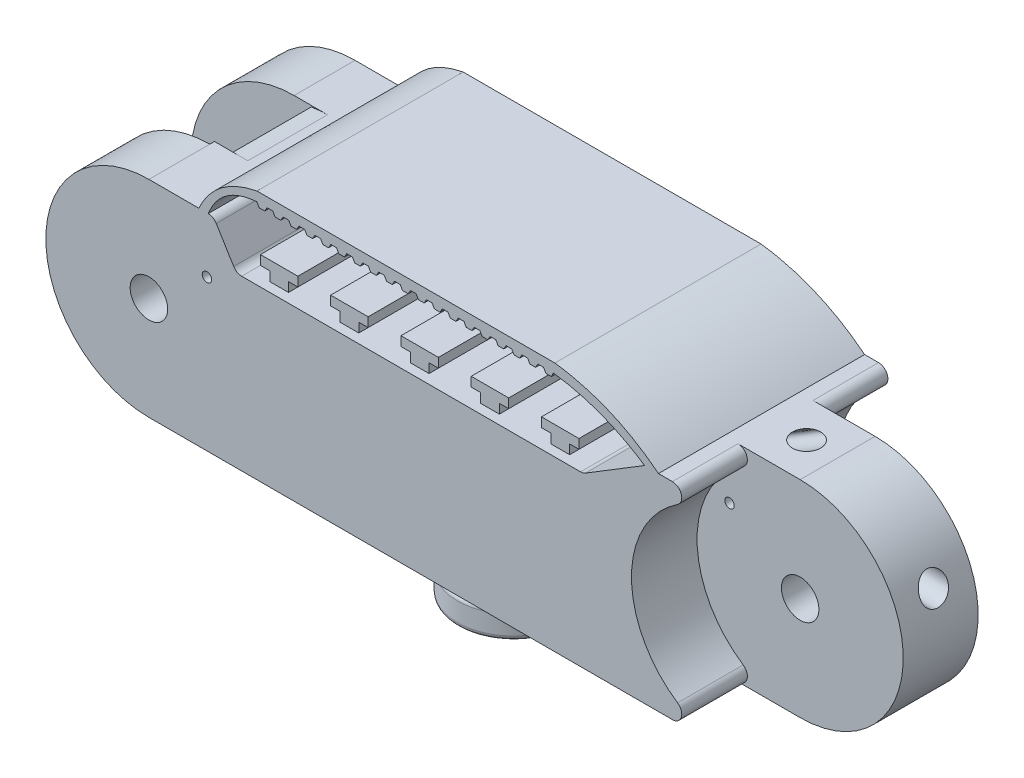
from build123d import *

# Parameters (mm, degrees)
GRIPPER_BODY_DEPTH                 = 11
SKETCH3_R                          = 11
CONNECTION_TO_GRIPPER_1_DEPTH      = 4.5
SKETCH6_R                          = 11
CUT_EXTRUDE8_DEPTH                 = 7
CUT_EXTRUDE9_START                 = -7
SKETCH7_R                          = 11
CUT_EXTRUDE9_DEPTH                 = 7
FILLET4_R                          = 1
FILLET5_R                          = 1
SKETCH9_R                          = 2
JOINT_HOLE_1_DEPTH                 = 8
JOINT_HOLES_2_DEPTH                = 55.847818861
JOINT_HOLES_2_DEPTH_BACK           = 55.847818861
SKETCH10_R                         = 2
SILICON_DEPRESSION_DEPTH           = 22
SKETCH12_W                         = 2
SKETCH12_H                         = 20
SILICON_HOLDER_BOTTOM_HALF_DEPTH   = 1
SKETCH13_W                         = 4
SKETCH13_H                         = 20
SILICON_HOLDER_TOP_HALF_DEPTH      = 1
SILICON_HOLDERS_COUNT              = 5
SILICON_HOLDERS_PITCH              = 7.5
SKETCH16_R                         = 0.5
TENDON_ROUTING_PINS_DEPTH          = 55.847818861
TENDON_HOLE_DEPTH                  = 52.432317017
TENDON_HOLE_DEPTH_BACK             = 52.432317017
SKETCH20_R                         = 1.5
SKETCH21_R                         = 4
ELASTIC_BAND_HOLDER_1ST_HALF_DEPTH = 5
SKETCH22_R                         = 6
ELASTIC_BAND_HOLDER_2ND_HALF_DEPTH = 3
FILLET9_R                          = 0.5
SKETCH26_W                         = 1.823369682
SKETCH26_H                         = 8.500690653
CUT_EXTRUDE12_DEPTH                = 10
FILLET10_R                         = 10
FILLET15_R                         = 1
BOSS_EXTRUDE1_DEPTH                = 22
SKETCH29_R                         = 1.5
CUT_EXTRUDE13_DEPTH                = 14


# Some blends are built 0.0001 mm under size
with BuildPart() as part:
    # Sketch1 → Gripper Body (new, symmetric)
    with BuildSketch(Plane.XY):
        with BuildLine():
            Line((-32.584884937, 24.992819745), (29.915115063, 24.992819745))
            ThreePointArc((29.915115063, 24.992819745), (40.915115063, 13.992819745), (29.915115063, 2.992819745))
            Line((29.915115063, 2.992819745), (18.774000035, 2.992819745))
            Line((18.774000035, 2.992819745), (-23.093344634, 2.992819745))
            Line((-23.093344634, 2.992819745), (-32.584884937, 2.992819745))
            ThreePointArc((-32.584884937, 2.992819745), (-43.584884937, 13.992819745), (-32.584884937, 24.992819745))
        make_face()
    extrude(amount=GRIPPER_BODY_DEPTH, both=True)

    # Sketch3 → Connection to Gripper 1 (cut, symmetric)
    with BuildSketch(Plane.XY):
        with Locations((-32.584884937, 13.992819745)):
            Circle(SKETCH3_R)
    extrude(amount=CONNECTION_TO_GRIPPER_1_DEPTH, both=True, mode=Mode.SUBTRACT)

    # Sketch6 → Cut-Extrude8 (cut)
    with BuildSketch(Plane.XY.offset(11)):
        with Locations((29.915115063, 13.992819745)):
            Circle(SKETCH6_R)
    extrude(amount=-CUT_EXTRUDE8_DEPTH, mode=Mode.SUBTRACT)

    # Sketch7 → Cut-Extrude9 (cut)
    with BuildSketch(Plane(origin=(0, 0, -11), x_dir=(-1, 0, 0), z_dir=(0, 0, -1)).offset(CUT_EXTRUDE9_START)):
        with Locations((-29.915115063, 13.992819745)):
            Circle(SKETCH7_R)
    extrude(amount=CUT_EXTRUDE9_DEPTH, mode=Mode.SUBTRACT)

    # Fillet4
    fillet4_edges = [part.edges().sort_by_distance(p)[0] for p in [
        (29.915115063, 24.992819745, 7.5),
        (29.915115063, 24.992819745, -7.5),
    ]]
    fillet(fillet4_edges, radius=FILLET4_R - 0.0001)  # a hair under: the kernel refuses the full size

    # Fillet5
    fillet5_edges = [part.edges().sort_by_distance(p)[0] for p in [
        (29.915115063, 2.992819745, 7.5),
        (29.915115063, 2.992819745, -7.5),
    ]]
    fillet(fillet5_edges, radius=FILLET5_R)

    # Sketch9 → Joint Hole 1 (cut)
    with BuildSketch(Plane(origin=(0, 0, -4), x_dir=(-1, 0, 0), z_dir=(0, 0, -1))):
        with Locations((-29.915115063, 13.992819745)):
            Circle(SKETCH9_R)
    extrude(amount=-JOINT_HOLE_1_DEPTH, mode=Mode.SUBTRACT)

    # Sketch10 → Joint Holes 2 (cut, two sides: drawn at the far end of the back side and taken through both)
    with BuildSketch(Plane(origin=(0, 0, -11), x_dir=(-1, 0, 0), z_dir=(0, 0, -1)).offset(-JOINT_HOLES_2_DEPTH_BACK)):
        with Locations((32.584884937, 13.992819745)):
            Circle(SKETCH10_R)
    extrude(amount=JOINT_HOLES_2_DEPTH + JOINT_HOLES_2_DEPTH_BACK, mode=Mode.SUBTRACT)

    # Sketch11 → Silicon Depression (cut)
    with BuildSketch(Plane(origin=(0, 0, -11), x_dir=(-1, 0, 0), z_dir=(0, 0, -1))):
        with BuildLine():
            Line((-20.308922647, 24.992819745), (25.691077353, 24.992819745))
            Line((25.691077353, 24.992819745), (23.539687492, 21.471466472))
            ThreePointArc((23.539687492, 21.471466472), (23.175553421, 21.120651965), (22.686346549, 20.992819745))
            Line((22.686346549, 20.992819745), (-13.480495522, 20.992819745))
            ThreePointArc((-13.480495522, 20.992819745), (-13.751289777, 21.030182497), (-14.001848795, 21.139478802))
            Line((-14.001848795, 21.139478802), (-20.308922647, 24.992819745))
        make_face()
    extrude(amount=-SILICON_DEPRESSION_DEPTH, mode=Mode.SUBTRACT)

    # Sketch12 → Silicon Holder Bottom Half (add)
    with BuildSketch(Plane(origin=(0, 20.992819745, 0), x_dir=(1, 0, 0), z_dir=(0, 1, 0))):
        with Locations((-19.686346549, 0)):
            Rectangle(SKETCH12_W, SKETCH12_H)
    silicon_holder_bottom_half = extrude(amount=SILICON_HOLDER_BOTTOM_HALF_DEPTH)

    # Sketch13 → Silicon Holder Top Half (add)
    with BuildSketch(Plane(origin=(0, 21.992819745, 0), x_dir=(1, 0, 0), z_dir=(0, 1, 0))):
        with Locations((-19.686346549, 0)):
            Rectangle(SKETCH13_W, SKETCH13_H)
    silicon_holder_top_half = extrude(amount=SILICON_HOLDER_TOP_HALF_DEPTH)

    # Silicon Holders: Silicon Holder Bottom Half, Silicon Holder Top Half ×5
    with Locations(*[(i * SILICON_HOLDERS_PITCH, 0, 0) for i in range(1, SILICON_HOLDERS_COUNT)]):
        add(silicon_holder_bottom_half)
        add(silicon_holder_top_half)

    # Sketch16 → Tendon Routing Pins (cut, through all)
    with BuildSketch(Plane(origin=(0, 0, -11), x_dir=(-1, 0, 0), z_dir=(0, 0, -1))):
        with Locations((-22.378601164, 19.058828465)):
            Circle(SKETCH16_R)
        with Locations((26.393313597, 19.058828465)):
            Circle(SKETCH16_R)
    extrude(amount=-TENDON_ROUTING_PINS_DEPTH, mode=Mode.SUBTRACT)

    # Sketch20 → Tendon Hole (cut, two sides: drawn at the far end of the back side and taken through both)
    with BuildSketch(Plane(origin=(0, 0, 0), x_dir=(0, 0, -1), z_dir=(1, 0, 0)).offset(-TENDON_HOLE_DEPTH_BACK)):
        with Locations((0, 18.008828465)):
            Circle(SKETCH20_R)
    extrude(amount=TENDON_HOLE_DEPTH + TENDON_HOLE_DEPTH_BACK, mode=Mode.SUBTRACT)

    # Sketch21 → Elastic Band Holder 1st Half (add)
    with BuildSketch(Plane.XZ.offset(-2.992819745)):
        with Locations(Location((-4.651509727, 0, 0), (0, 0, 180))):
            Circle(SKETCH21_R)
    extrude(amount=ELASTIC_BAND_HOLDER_1ST_HALF_DEPTH)

    # Sketch22 → Elastic Band Holder 2nd Half (add)
    with BuildSketch(Plane.XZ.offset(2.007180255)):
        with Locations((-4.651509727, 0)):
            Circle(SKETCH22_R)
    extrude(amount=ELASTIC_BAND_HOLDER_2ND_HALF_DEPTH)

    # Fillet9
    fillet9_edges = [part.edges().sort_by_distance(p)[0] for p in [
        (-0.651509727, -2.007180255, 0),
        (-10.651509727, -2.007180255, 0),
        (-10.651509727, -5.007180255, 0),
    ]]
    fillet(fillet9_edges, radius=FILLET9_R)

    # Sketch26 → Cut-Extrude12 (cut)
    with BuildSketch(Plane(origin=(0, 24.992819745, 0), x_dir=(1, 0, 0), z_dir=(0, 1, 0))):
        with Locations((-31.673200096, 0.249654673)):
            Rectangle(SKETCH26_W, SKETCH26_H)
    extrude(amount=-CUT_EXTRUDE12_DEPTH, mode=Mode.SUBTRACT)

    # Fillet10
    # the kernel refuses this fillet: 10 mm, written as the material it takes off along each edge
    with BuildSketch(Plane(origin=(-30.761515255, 24.992819745, -4.5), x_dir=(1, 0, 0), z_dir=(0, 0, 1))) as fillet10_piece_1:
        with BuildLine():
            CenterArc((1.737909218, -10), FILLET10_R, 90, 10.00830491)
            Line((0, -0.152174273), (0, 0))
            Line((0, 0), (1.737909218, 0))
        make_face()
    extrude(amount=8.500690653, mode=Mode.SUBTRACT)

    # Fillet15
    fillet15_edges = [part.edges().sort_by_distance(p)[0] for p in [
        (-25.691077353, 24.992819745, 0),
    ]]
    fillet(fillet15_edges, radius=FILLET15_R)

    # Sketch27 → Boss-Extrude1 (add)
    with BuildSketch(Plane.XY.offset(11)):
        with BuildLine():
            Line((-21.067124005, 28.683374966), (-20.817124005, 28.250362264))
            Line((-20.817124005, 28.250362264), (-20.217124005, 28.250362264))
            Line((-20.217124005, 28.250362264), (-19.967124005, 28.683374966))
            Line((-19.967124005, 28.683374966), (-19.367124005, 28.683374966))
            Line((-19.367124005, 28.683374966), (-19.117124005, 28.250362264))
            Line((-19.117124005, 28.250362264), (-18.517124005, 28.250362264))
            Line((-18.517124005, 28.250362264), (-18.267124005, 28.683374966))
            Line((-18.267124005, 28.683374966), (-17.667124005, 28.683374966))
            Line((-17.667124005, 28.683374966), (-17.417124005, 28.250362264))
            Line((-17.417124005, 28.250362264), (-16.817124005, 28.250362264))
            Line((-16.817124005, 28.250362264), (-16.567124005, 28.683374966))
            Line((-16.567124005, 28.683374966), (-15.967124005, 28.683374966))
            Line((-15.967124005, 28.683374966), (-15.717124005, 28.250362264))
            Line((-15.717124005, 28.250362264), (-15.117124005, 28.250362264))
            Line((-15.117124005, 28.250362264), (-14.867124005, 28.683374966))
            Line((-14.867124005, 28.683374966), (-14.267124005, 28.683374966))
            Line((-14.267124005, 28.683374966), (-14.017124005, 28.250362264))
            Line((-14.017124005, 28.250362264), (-13.417124005, 28.250362264))
            Line((-13.417124005, 28.250362264), (-13.167124005, 28.683374966))
            Line((-13.167124005, 28.683374966), (-12.567124005, 28.683374966))
            Line((-12.567124005, 28.683374966), (-12.317124005, 28.250362264))
            Line((-12.317124005, 28.250362264), (-11.717124005, 28.250362264))
            Line((-11.717124005, 28.250362264), (-11.467124005, 28.683374966))
            Line((-11.467124005, 28.683374966), (-10.867124005, 28.683374966))
            Line((-10.867124005, 28.683374966), (-10.617124005, 28.250362264))
            Line((-10.617124005, 28.250362264), (-10.017124005, 28.250362264))
            Line((-10.017124005, 28.250362264), (-9.767124005, 28.683374966))
            Line((-9.767124005, 28.683374966), (-9.167124005, 28.683374966))
            Line((-9.167124005, 28.683374966), (-8.917124005, 28.250362264))
            Line((-8.917124005, 28.250362264), (-8.317124005, 28.250362264))
            Line((-8.317124005, 28.250362264), (-8.067124005, 28.683374966))
            Line((-8.067124005, 28.683374966), (-7.467124005, 28.683374966))
            Line((-7.467124005, 28.683374966), (-7.217124005, 28.250362264))
            Line((-7.217124005, 28.250362264), (-6.617124005, 28.250362264))
            Line((-6.617124005, 28.250362264), (-6.367124005, 28.683374966))
            Line((-6.367124005, 28.683374966), (-5.767124005, 28.683374966))
            Line((-5.767124005, 28.683374966), (-5.517124005, 28.250362264))
            Line((-5.517124005, 28.250362264), (-4.917124005, 28.250362264))
            Line((-4.917124005, 28.250362264), (-4.667124005, 28.683374966))
            Line((-4.667124005, 28.683374966), (-4.067124005, 28.683374966))
            Line((-4.067124005, 28.683374966), (-3.817124005, 28.250362264))
            Line((-3.817124005, 28.250362264), (-3.217124005, 28.250362264))
            Line((-3.217124005, 28.250362264), (-2.967124005, 28.683374966))
            Line((-2.967124005, 28.683374966), (-2.367124005, 28.683374966))
            Line((-2.367124005, 28.683374966), (-2.117124005, 28.250362264))
            Line((-2.117124005, 28.250362264), (-1.517124005, 28.250362264))
            Line((-1.517124005, 28.250362264), (-1.267124005, 28.683374966))
            Line((-1.267124005, 28.683374966), (-0.667124005, 28.683374966))
            Line((-0.667124005, 28.683374966), (-0.417124005, 28.250362264))
            Line((-0.417124005, 28.250362264), (0.182875995, 28.250362264))
            Line((0.182875995, 28.250362264), (0.432875995, 28.683374966))
            Line((0.432875995, 28.683374966), (1.032875995, 28.683374966))
            Line((1.032875995, 28.683374966), (1.282875995, 28.250362264))
            Line((1.282875995, 28.250362264), (1.882875995, 28.250362264))
            Line((1.882875995, 28.250362264), (2.132875995, 28.683374966))
            Line((2.132875995, 28.683374966), (2.732875995, 28.683374966))
            Line((2.732875995, 28.683374966), (2.982875995, 28.250362264))
            Line((2.982875995, 28.250362264), (3.582875995, 28.250362264))
            Line((3.582875995, 28.250362264), (3.832875995, 28.683374966))
            Line((3.832875995, 28.683374966), (4.432875995, 28.683374966))
            Line((4.432875995, 28.683374966), (4.682875995, 28.250362264))
            Line((4.682875995, 28.250362264), (5.282875995, 28.250362264))
            Line((5.282875995, 28.250362264), (5.532875995, 28.683374966))
            Line((5.532875995, 28.683374966), (6.132875995, 28.683374966))
            Line((6.132875995, 28.683374966), (6.382875995, 28.250362264))
            Line((6.382875995, 28.250362264), (6.982875995, 28.250362264))
            Line((6.982875995, 28.250362264), (7.232875995, 28.683374966))
            Line((7.232875995, 28.683374966), (7.832875995, 28.683374966))
            Line((7.832875995, 28.683374966), (8.082875995, 28.250362264))
            Line((8.082875995, 28.250362264), (8.682875995, 28.250362264))
            Line((8.682875995, 28.250362264), (8.932875995, 28.683374966))
            Line((8.932875995, 28.683374966), (9.532875995, 28.683374966))
            Line((9.532875995, 28.683374966), (9.782875995, 28.250362264))
            Line((9.782875995, 28.250362264), (10.382875995, 28.250362264))
            Line((10.382875995, 28.250362264), (10.569327479, 28.683374966))
            add(Edge.make_bspline(
                [(20.308922647, 24.992819745), (15.900183853, 27.993611621), (10.569327479, 28.683374966)],
                knots=[0, 0, 0, 1, 1, 1], degree=2))
            Line((20.308922647, 24.992819745), (21.795394065, 24.992819745))
            add(Edge.make_bspline(
                [(21.795394065, 24.992819745), (16.935308193, 28.871226783), (10.742219848, 29.683244785)],
                knots=[0, 0, 0, 1, 1, 1], degree=2))
            Line((10.742219848, 29.683244785), (-21.050988782, 29.683244785))
            add(Edge.make_bspline(
                [(-27.251986485, 24.992819745), (-25.512184441, 28.823590808), (-21.050988782, 29.683244785)],
                knots=[0, 0, 0, 1, 1, 1], degree=2))
            Line((-27.251986485, 24.992819745), (-26.251986485, 24.992819745))
            add(Edge.make_bspline(
                [(-26.251986485, 24.992819745), (-24.931646695, 28.373990657), (-21.067124005, 28.683374966)],
                knots=[0, 0, 0, 1, 1, 1], degree=2))
        make_face()
    extrude(amount=-BOSS_EXTRUDE1_DEPTH)

    # Sketch29 → Cut-Extrude13 (cut, along a direction that is not the sketch's normal)
    with BuildSketch(Plane(origin=(0, 24.992819745, 0), x_dir=(1, 0, 0), z_dir=(0, 1, 0))):
        with Locations((26.598490273, 0)):
            Circle(SKETCH29_R)
    extrude(amount=-CUT_EXTRUDE13_DEPTH, dir=(0.8533409430122538, 0.5213532727229757, 0), mode=Mode.SUBTRACT)


solid = part.part
